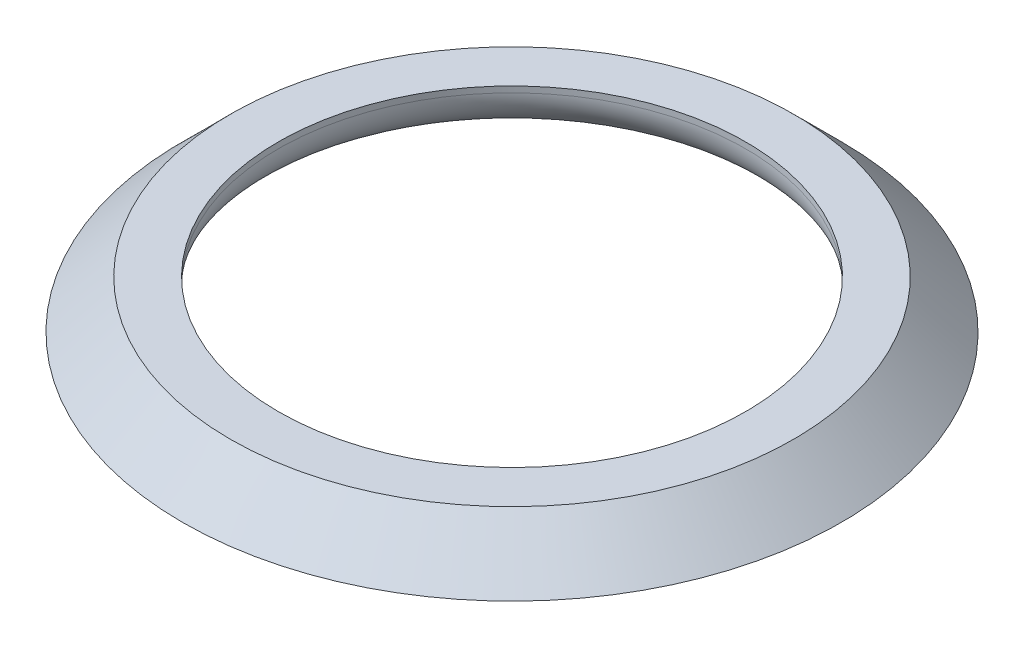
from build123d import *

# Parameters (mm, degrees)
SKETCH1_R           = 13.75
SKETCH1_R_2         = 9.75
BOSS_EXTRUDE1_DEPTH = 2
CHAMFER1_SIZE       = 2
FILLET1_R           = 1.75


with BuildPart() as part:
    # Sketch1 → Boss-Extrude1 (new body)
    with BuildSketch(Plane(origin=(0, 0, 0), x_dir=(1, 0, 0), z_dir=(0, 1, 0))):
        with Locations(Location((0, 0, 0), (0, 0, 270))):
            Circle(SKETCH1_R)
        with Locations(Location((0, 0, 0), (0, 0, 270))):
            Circle(SKETCH1_R_2, mode=Mode.SUBTRACT)
    extrude(amount=BOSS_EXTRUDE1_DEPTH)

    # Chamfer1
    chamfer1_edges = [part.edges().sort_by_distance(p)[0] for p in [
        (0, 2, -13.75),
    ]]
    chamfer(chamfer1_edges, length=CHAMFER1_SIZE - 0.0001)  # a hair under: the kernel refuses the full size

    # Fillet1
    fillet1_edges = [part.edges().sort_by_distance(p)[0] for p in [
        (0, 0, -9.75),
    ]]
    fillet(fillet1_edges, radius=FILLET1_R)


solid = part.part
